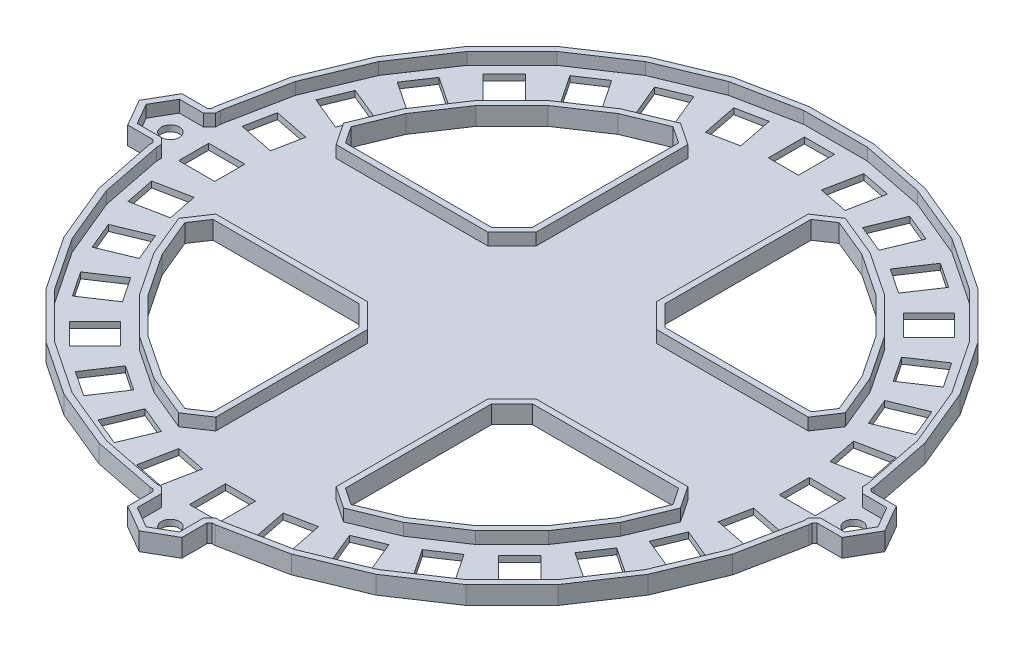
from build123d import *

# Parameters (mm, degrees)
BOSS_EXTRUDE1_DEPTH = 2
SKETCH3_W           = 20
SKETCH3_H           = 87.5
BOSS_EXTRUDE4_DEPTH = 2
CIRPATTERN1_COUNT   = 2
CIRPATTERN1_ANGLE   = 90
CHAMFER1_DEPTH      = 2
SKETCH5_R           = 1.5
BOSS_EXTRUDE6_DEPTH = 2
CHAMFER3_SIZE       = 1
SHELL1_T            = 1
CUT_EXTRUDE1_START  = -3
SKETCH7_R           = 1.5
CUT_EXTRUDE1_DEPTH  = 3
SKETCH8_W           = 5
SKETCH8_H           = 6
SKETCH8_W_2         = 6
SKETCH8_H_2         = 5
CUT_EXTRUDE2_DEPTH  = 1


with BuildPart() as part:
    # Sketch1 → Boss-Extrude1 (new body)
    with BuildSketch(Plane(origin=(0, 0, 0), x_dir=(1, 0, 0), z_dir=(0, 1, 0))):
        Polygon((53.75, 5.29391293), (51.684417643, 15.678296686), (47.632632102, 25.460172293), (41.750351221, 34.263627757), (34.263627757, 41.750351221), (25.460172293, 47.632632102), (15.678296686, 51.684417643), (5.29391293, 53.75), (-5.29391293, 53.75), (-15.678296686, 51.684417643), (-25.460172293, 47.632632102), (-34.263627757, 41.750351221), (-41.750351221, 34.263627757), (-47.632632102, 25.460172293), (-51.684417643, 15.678296686), (-53.75, 5.29391293), (-53.75, -5.29391293), (-51.684417643, -15.678296686), (-47.632632102, -25.460172293), (-41.750351221, -34.263627757), (-34.263627757, -41.750351221), (-25.460172293, -47.632632102), (-15.678296686, -51.684417643), (-5.29391293, -53.75), (5.29391293, -53.75), (15.678296686, -51.684417643), (25.460172293, -47.632632102), (34.263627757, -41.750351221), (41.750351221, -34.263627757), (47.632632102, -25.460172293), (51.684417643, -15.678296686), (53.75, -5.29391293), align=None)
        Polygon((43.75, 4.308998897), (42.068712035, 12.76140428), (38.770747059, 20.723396052), (33.982844017, 27.888999337), (27.888999337, 33.982844017), (20.723396052, 38.770747059), (12.76140428, 42.068712035), (4.308998897, 43.75), (-4.308998897, 43.75), (-12.76140428, 42.068712035), (-20.723396052, 38.770747059), (-27.888999337, 33.982844017), (-33.982844017, 27.888999337), (-38.770747059, 20.723396052), (-42.068712035, 12.76140428), (-43.75, 4.308998897), (-43.75, -4.308998897), (-42.068712035, -12.76140428), (-38.770747059, -20.723396052), (-33.982844017, -27.888999337), (-27.888999337, -33.982844017), (-20.723396052, -38.770747059), (-12.76140428, -42.068712035), (-4.308998897, -43.75), (4.308998897, -43.75), (12.76140428, -42.068712035), (20.723396052, -38.770747059), (27.888999337, -33.982844017), (33.982844017, -27.888999337), (38.770747059, -20.723396052), (42.068712035, -12.76140428), (43.75, -4.308998897), align=None, mode=Mode.SUBTRACT)
    extrude(amount=BOSS_EXTRUDE1_DEPTH)

    # Sketch3 → Boss-Extrude4 (add)
    with BuildSketch(Plane(origin=(0, 2, 0), x_dir=(1, 0, 0), z_dir=(0, 1, 0))):
        Rectangle(SKETCH3_W, SKETCH3_H)
    boss_extrude4 = extrude(amount=-BOSS_EXTRUDE4_DEPTH)

    # CirPattern1: Boss-Extrude4 ×2 about axis
    cirpattern1_axis = Axis((0, 2, 0), (0, 1, 0))
    for i in range(1, CIRPATTERN1_COUNT):
        add(boss_extrude4.rotate(cirpattern1_axis, i * CIRPATTERN1_ANGLE / (CIRPATTERN1_COUNT - 1)))

    # Chamfer1: read off the stored shape, not the designer's step
    # Chamfer1 outline → Chamfer1 (add)
    with BuildSketch(Plane(origin=(0, 0, 0), x_dir=(1, 0, 0), z_dir=(0, 1, 0))):
        Polygon((10, -10), (10, -14), (14, -10), align=None)
        Polygon((13.692057296, -41.683222934), (10, -39.216269119), (10, -42.617989498), (12.76140428, -42.068712035), align=None)
        Polygon((42.617989498, -10), (39.216269119, -10), (41.683222934, -13.692057296), (42.068712035, -12.76140428), align=None)
        Polygon((-10, 10), (-10, 14), (-14, 10), align=None)
        Polygon((-13.692057296, 41.683222934), (-10, 39.216269119), (-10, 42.617989498), (-12.76140428, 42.068712035), align=None)
        Polygon((-42.617989498, 10), (-39.216269119, 10), (-41.683222934, 13.692057296), (-42.068712035, 12.76140428), align=None)
        Polygon((10, 10), (14, 10), (10, 14), align=None)
        Polygon((41.683222934, 13.692057296), (39.216269119, 10), (42.617989498, 10), (42.068712035, 12.76140428), align=None)
        Polygon((10, 42.617989498), (10, 39.216269119), (13.692057296, 41.683222934), (12.76140428, 42.068712035), align=None)
        Polygon((-10, -10), (-14, -10), (-10, -14), align=None)
        Polygon((-41.683222934, -13.692057296), (-39.216269119, -10), (-42.617989498, -10), (-42.068712035, -12.76140428), align=None)
        Polygon((-10, -42.617989498), (-10, -39.216269119), (-13.692057296, -41.683222934), (-12.76140428, -42.068712035), align=None)
    extrude(amount=CHAMFER1_DEPTH)

    # Sketch5 → Boss-Extrude6 (add)
    # profile 1 of 3: a face of its own
    with BuildSketch(Plane(origin=(0, 2, 0), x_dir=(1, 0, 0), z_dir=(0, 1, 0))):
        Polygon((-54.729274058, 3.5), (-58.770725942, 3.5), (-60.791451884, 0), (-58.770725942, -3.5), (-54.729274058, -3.5), (-53.75, -3.5), (-53.75, 3.5), align=None)
        with Locations(Location((-56.75, 0, 0), (0, 0, 270))):
            Circle(SKETCH5_R, mode=Mode.SUBTRACT)
    # profile 2 of 3: a face of its own
    with BuildSketch(Plane(origin=(0, 2, 0), x_dir=(1, 0, 0), z_dir=(0, 1, 0))):
        Polygon((54.729274058, 3.5), (53.75, 3.5), (53.75, -3.5), (54.729274058, -3.5), (58.770725942, -3.5), (60.791451884, 0), (58.770725942, 3.5), align=None)
        with Locations(Location((56.75, 0, 0), (0, 0, 270))):
            Circle(SKETCH5_R, mode=Mode.SUBTRACT)
    # profile 3 of 3: a face of its own
    with BuildSketch(Plane(origin=(0, 2, 0), x_dir=(1, 0, 0), z_dir=(0, 1, 0))):
        Polygon((3.5, -54.729274058), (3.5, -53.75), (-3.5, -53.75), (-3.5, -54.729274058), (-3.5, -58.770725942), (0, -60.791451884), (3.5, -58.770725942), align=None)
        with Locations(Location((0, -56.75, 0), (0, 0, 270))):
            Circle(SKETCH5_R, mode=Mode.SUBTRACT)
    extrude(amount=-BOSS_EXTRUDE6_DEPTH)

    # Chamfer3
    chamfer3_edges = [part.edges().sort_by_distance(p)[0] for p in [
        (-53.75, 1, 3.5),
        (-53.75, 1, -3.5),
        (53.75, 1, -3.5),
        (53.75, 1, 3.5),
        (3.5, 1, 53.75),
        (-3.5, 1, 53.75),
    ]]
    chamfer(chamfer3_edges, length=CHAMFER3_SIZE)

    # Shell1
    shell1_openings = [part.faces().sort_by_distance(p)[0] for p in [
        (0, 2, 0.323441479),
    ]]
    offset(amount=SHELL1_T, openings=shell1_openings, kind=Kind.INTERSECTION)

    # Sketch7 → Cut-Extrude1 (cut)
    with BuildSketch(Plane.XZ.offset(1).offset(CUT_EXTRUDE1_START)):
        with Locations(Location((0, 56.75, 0), (0, 0, 270))):
            Circle(SKETCH7_R)
        with Locations(Location((-56.75, 0, 0), (0, 0, 270))):
            Circle(SKETCH7_R)
        with Locations(Location((56.75, 0, 0), (0, 0, 270))):
            Circle(SKETCH7_R)
    extrude(amount=CUT_EXTRUDE1_DEPTH, mode=Mode.SUBTRACT)

    # Sketch8 → Cut-Extrude2 (cut)
    with BuildSketch(Plane.XZ.offset(1)):
        Polygon((7.403285747, 45.420160239), (8.573827679, 51.304871922), (13.477754081, 50.329420312), (12.307212149, 44.444708629), align=None)
        with Locations((0.9, 48.991733997)):
            Rectangle(SKETCH8_W, SKETCH8_H)
        Polygon((16.122067374, 43.103115196), (18.418167968, 48.646392391), (23.037565631, 46.732975229), (20.741465037, 41.189698034), align=None)
        Polygon((24.221286994, 39.129641608), (27.554708392, 44.118459282), (31.712056453, 41.340608117), (28.378635055, 36.351790443), align=None)
        Polygon((31.389696138, 33.652437837), (35.632336825, 37.895078525), (39.167870731, 34.359544619), (34.925230044, 30.116903932), align=None)
        Polygon((37.351816862, 26.881989753), (42.340634536, 30.215411151), (45.118485701, 26.05806309), (40.129668028, 22.724641692), align=None)
        Polygon((41.878528212, 19.078481878), (47.421805408, 21.374582472), (49.335222569, 16.75518481), (43.791945374, 14.459084216), align=None)
        Polygon((44.795871209, 10.541798644), (50.680582891, 11.712340576), (51.656034501, 6.808414174), (45.771322819, 5.637872242), align=None)
        with Locations((48.991733997, -0.9)):
            Rectangle(SKETCH8_W_2, SKETCH8_H_2)
        Polygon((45.420160239, -7.403285747), (51.304871922, -8.573827679), (50.329420312, -13.477754081), (44.444708629, -12.307212149), align=None)
        Polygon((43.103115196, -16.122067374), (48.646392391, -18.418167968), (46.732975229, -23.037565631), (41.189698034, -20.741465037), align=None)
        Polygon((39.129641608, -24.221286994), (44.118459282, -27.554708392), (41.340608117, -31.712056453), (36.351790443, -28.378635055), align=None)
        Polygon((33.652437837, -31.389696138), (37.895078525, -35.632336825), (34.359544619, -39.167870731), (30.116903932, -34.925230044), align=None)
        Polygon((26.881989753, -37.351816862), (30.215411151, -42.340634536), (26.05806309, -45.118485701), (22.724641692, -40.129668028), align=None)
        Polygon((19.078481878, -41.878528212), (21.374582472, -47.421805408), (16.75518481, -49.335222569), (14.459084216, -43.791945374), align=None)
        Polygon((10.541798644, -44.795871209), (11.712340576, -50.680582891), (6.808414174, -51.656034501), (5.637872242, -45.771322819), align=None)
        with Locations((-0.9, -48.991733997)):
            Rectangle(SKETCH8_W, SKETCH8_H)
        Polygon((-7.403285747, -45.420160239), (-8.573827679, -51.304871922), (-13.477754081, -50.329420312), (-12.307212149, -44.444708629), align=None)
        Polygon((-16.122067374, -43.103115196), (-18.418167968, -48.646392391), (-23.037565631, -46.732975229), (-20.741465037, -41.189698034), align=None)
        Polygon((-24.221286994, -39.129641608), (-27.554708392, -44.118459282), (-31.712056453, -41.340608117), (-28.378635055, -36.351790443), align=None)
        Polygon((-31.389696138, -33.652437837), (-35.632336825, -37.895078525), (-39.167870731, -34.359544619), (-34.925230044, -30.116903932), align=None)
        Polygon((-37.351816862, -26.881989753), (-42.340634536, -30.215411151), (-45.118485701, -26.05806309), (-40.129668028, -22.724641692), align=None)
        Polygon((-41.878528212, -19.078481878), (-47.421805408, -21.374582472), (-49.335222569, -16.75518481), (-43.791945374, -14.459084216), align=None)
        Polygon((-44.795871209, -10.541798644), (-50.680582891, -11.712340576), (-51.656034501, -6.808414174), (-45.771322819, -5.637872242), align=None)
        with Locations((-48.991733997, 0.9)):
            Rectangle(SKETCH8_W_2, SKETCH8_H_2)
        Polygon((-45.420160239, 7.403285747), (-51.304871922, 8.573827679), (-50.329420312, 13.477754081), (-44.444708629, 12.307212149), align=None)
        Polygon((-43.103115196, 16.122067374), (-48.646392391, 18.418167968), (-46.732975229, 23.037565631), (-41.189698034, 20.741465037), align=None)
        Polygon((-39.129641608, 24.221286994), (-44.118459282, 27.554708392), (-41.340608117, 31.712056453), (-36.351790443, 28.378635055), align=None)
        Polygon((-33.652437837, 31.389696138), (-37.895078525, 35.632336825), (-34.359544619, 39.167870731), (-30.116903932, 34.925230044), align=None)
        Polygon((-26.881989753, 37.351816862), (-30.215411151, 42.340634536), (-26.05806309, 45.118485701), (-22.724641692, 40.129668028), align=None)
        Polygon((-19.078481878, 41.878528212), (-21.374582472, 47.421805408), (-16.75518481, 49.335222569), (-14.459084216, 43.791945374), align=None)
        Polygon((-10.541798644, 44.795871209), (-11.712340576, 50.680582891), (-6.808414174, 51.656034501), (-5.637872242, 45.771322819), align=None)
    extrude(amount=-CUT_EXTRUDE2_DEPTH, mode=Mode.SUBTRACT)


solid = part.part
